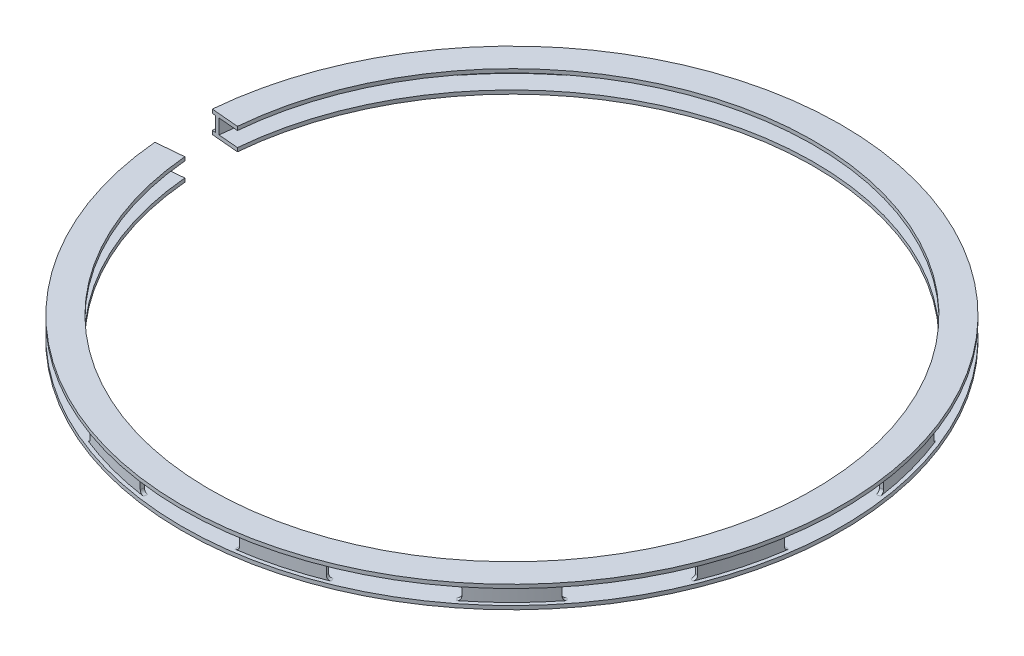
from build123d import *
from build123d.topology import SkipClean

# Parameters (mm, degrees)
REVOLVE1_ANGLE           = 350
SKETCH2_W                = 1
SKETCH2_H                = 2
CUT_REVOLVE1_ANGLE       = 17.5
FILLET1_R                = 0.5
CIRPATTERN1_COUNT        = 12
FILLET1_OF_CIRPATTERN1_R = 0.5


with BuildPart() as part:
    # Sketch1 → Revolve1 (revolve, symmetric)
    with SkipClean():  # the faces are left unmerged after this step: merging them gives an invalid solid
        with BuildSketch(Plane.XY) as revolve1_sk:
            Polygon((41, 3), (41, 2.5), (43.75, 2.5), (43.75, 0.5), (41, 0.5), (41, 0), (44.75, 0), (44.75, 0.5), (44.25, 0.5), (44.25, 2.5), (44.75, 2.5), (44.75, 3), align=None)
        revolve(axis=Axis((0, 0, 0), (0, 1, 0)), revolution_arc=REVOLVE1_ANGLE / 2)
        revolve(revolve1_sk.sketch, axis=Axis((0, 0, 0), (0, -1, 0)), revolution_arc=REVOLVE1_ANGLE / 2)
    add(part.part.scale(1), mode=Mode.REPLACE)  # the faces are merged on a copy

    # Sketch2 → Cut-Revolve1 (revolve, symmetric, cut)
    with BuildSketch(Plane.XY) as cut_revolve1_sk:
        with Locations((43.75, 1.5)):
            Rectangle(SKETCH2_W, SKETCH2_H)
    cut_revolve1 = revolve(axis=Axis((0, 0, 0), (0, 1, 0)), revolution_arc=CUT_REVOLVE1_ANGLE / 2, mode=Mode.SUBTRACT)
    cut_revolve1 = cut_revolve1 + revolve(cut_revolve1_sk.sketch, axis=Axis((0, 0, 0), (0, -1, 0)), revolution_arc=CUT_REVOLVE1_ANGLE / 2, mode=Mode.SUBTRACT)

    # Fillet1
    fillet1_edges = [part.edges().sort_by_distance(p)[0] for p in [
        (43.487906461, 2.5, 6.693428992),
        (43.487906461, 0.5, 6.693428992),
        (43.487906461, 0.5, -6.693428992),
        (43.487906461, 2.5, -6.693428992),
    ]]
    fillet(fillet1_edges, radius=FILLET1_R)

    # CirPattern1: Cut-Revolve1 ×12 about axis, 1 skipped
    cirpattern1_axis = Axis((0, 0.5, 0), (0, -1, 0))
    add([cut_revolve1.rotate(cirpattern1_axis, i * 360 / CIRPATTERN1_COUNT) for i in range(1, CIRPATTERN1_COUNT) if i not in (6,)], mode=Mode.SUBTRACT)

    # Fillet1 of CirPattern1
    fillet1_of_cirpattern1_edges = [part.edges().sort_by_distance(p)[0] for p in [
        (34.314917256, 2.5, 27.540632776),
        (34.314917256, 0.5, 27.540632776),
        (41.008346248, 0.5, 15.947273684),
        (41.008346248, 2.5, 15.947273684),
        (15.947273684, 2.5, 41.008346248),
        (15.947273684, 0.5, 41.008346248),
        (27.540632776, 0.5, 34.314917256),
        (27.540632776, 2.5, 34.314917256),
        (-6.693428992, 2.5, 43.487906461),
        (-6.693428992, 0.5, 43.487906461),
        (6.693428992, 0.5, 43.487906461),
        (6.693428992, 2.5, 43.487906461),
        (-27.540632776, 2.5, 34.314917256),
        (-27.540632776, 0.5, 34.314917256),
        (-15.947273684, 0.5, 41.008346248),
        (-15.947273684, 2.5, 41.008346248),
        (-41.008346248, 2.5, 15.947273684),
        (-41.008346248, 0.5, 15.947273684),
        (-34.314917256, 0.5, 27.540632776),
        (-34.314917256, 2.5, 27.540632776),
        (-34.314917256, 2.5, -27.540632776),
        (-34.314917256, 0.5, -27.540632776),
        (-41.008346248, 0.5, -15.947273684),
        (-41.008346248, 2.5, -15.947273684),
        (-15.947273684, 2.5, -41.008346248),
        (-15.947273684, 0.5, -41.008346248),
        (-27.540632776, 0.5, -34.314917256),
        (-27.540632776, 2.5, -34.314917256),
        (6.693428992, 2.5, -43.487906461),
        (6.693428992, 0.5, -43.487906461),
        (-6.693428992, 0.5, -43.487906461),
        (-6.693428992, 2.5, -43.487906461),
        (27.540632776, 2.5, -34.314917256),
        (27.540632776, 0.5, -34.314917256),
        (15.947273684, 0.5, -41.008346248),
        (15.947273684, 2.5, -41.008346248),
        (41.008346248, 2.5, -15.947273684),
        (41.008346248, 0.5, -15.947273684),
        (34.314917256, 0.5, -27.540632776),
        (34.314917256, 2.5, -27.540632776),
    ]]
    fillet(fillet1_of_cirpattern1_edges, radius=FILLET1_OF_CIRPATTERN1_R)


solid = part.part
